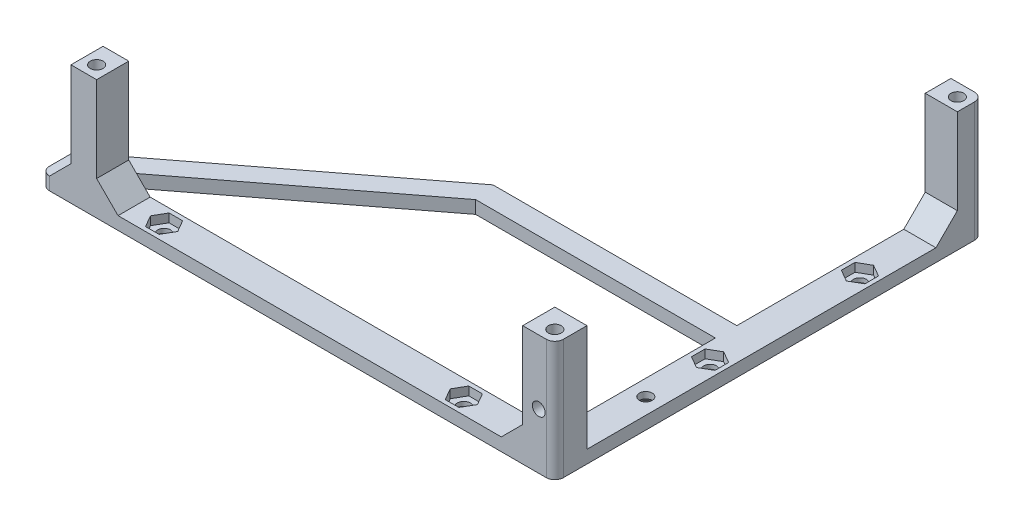
from build123d import *

# Parameters (mm, degrees)
SKETCH1_R               = 1.5
BOSS_EXTRUDE1_DEPTH     = 3
SKETCH2_W               = 6
SKETCH2_H               = 7.5
BOSS_EXTRUDE2_DEPTH     = 25
CHAMFER3_SIZE           = 5
CHAMFER6_SIZE           = 5
CHAMFER8_SIZE           = 5
SKETCH3_R               = 1.5
CUT_EXTRUDE1_DEPTH      = 107.236732571
BOSS_EXTRUDE3_DEPTH     = 3
CUT_EXTRUDE2_DEPTH      = 2
CUT_EXTRUDE3_DEPTH      = 10
CUT_EXTRUDE3_DEPTH_BACK = 106.977560584
SKETCH6_R               = 1.5
SKETCH9_R               = 1.493282486
CUT_EXTRUDE4_DEPTH      = 10
CHAMFER9_SIZE           = 1.5


with BuildPart() as part:
    # Sketch1 → Boss-Extrude1 (new body)
    with BuildSketch(Plane(origin=(0, 0, 0), x_dir=(1, 0, 0), z_dir=(0, 1, 0))):
        with BuildLine():
            Line((40.047169811, 27.523584906), (44.547169811, 27.523584906))
            Line((44.547169811, 27.523584906), (45.547169811, 27.523584906))
            ThreePointArc((45.547169811, 27.523584906), (46.961383374, 26.937798468), (47.547169811, 25.523584906))
            Line((47.547169811, 25.523584906), (47.547169811, 24.523584906))
            Line((47.547169811, 24.523584906), (47.547169811, -70.476415094))
            ThreePointArc((47.547169811, -70.476415094), (46.961383374, -71.890628657), (45.547169811, -72.476415094))
            Line((45.547169811, -72.476415094), (-69.452830189, -72.476415094))
            Line((-69.452830189, -72.476415094), (-70.452830189, -72.476415094))
            ThreePointArc((-70.452830189, -72.476415094), (-71.867043751, -71.890628657), (-72.452830189, -70.476415094))
            Line((-72.452830189, -70.476415094), (-72.452830189, -69.476415094))
            Line((-72.452830189, -69.476415094), (-72.452830189, -64.976415094))
            Line((-72.452830189, -64.976415094), (40.047169811, -64.976415094))
            Line((40.047169811, -64.976415094), (40.047169811, 27.523584906))
        make_face()
        with Locations(Location((44.547169811, 24.523584906, 0), (0, 0, 270))):
            Circle(SKETCH1_R, mode=Mode.SUBTRACT)
        with Locations(Location((44.547169811, -69.476415094, 0), (0, 0, 270))):
            Circle(SKETCH1_R, mode=Mode.SUBTRACT)
        with Locations(Location((-62.452830189, -69.476415094, 0), (0, 0, 270))):
            Circle(SKETCH1_R, mode=Mode.SUBTRACT)
    extrude(amount=BOSS_EXTRUDE1_DEPTH)

    # Sketch2 → Boss-Extrude2 (add)
    with BuildSketch(Plane(origin=(0, 3, 0), x_dir=(1, 0, 0), z_dir=(0, 1, 0))):
        with BuildLine():
            Line((40.047169811, -64.976415094), (47.547169811, -64.976415094))
            Line((47.547169811, -64.976415094), (47.547169811, -70.476415094))
            ThreePointArc((47.547169811, -70.476415094), (46.961383374, -71.890628657), (45.547169811, -72.476415094))
            Line((45.547169811, -72.476415094), (40.047169811, -72.476415094))
            Line((40.047169811, -72.476415094), (40.047169811, -64.976415094))
        make_face()
        with Locations((-62.452830189, -68.726415094)):
            Rectangle(SKETCH2_W, SKETCH2_H)
        with BuildLine():
            Line((40.047169811, 21.523584906), (47.547169811, 21.523584906))
            Line((47.547169811, 21.523584906), (47.547169811, 25.523584906))
            ThreePointArc((47.547169811, 25.523584906), (46.961383374, 26.937798468), (45.547169811, 27.523584906))
            Line((45.547169811, 27.523584906), (40.047169811, 27.523584906))
            Line((40.047169811, 27.523584906), (40.047169811, 21.523584906))
        make_face()
    extrude(amount=BOSS_EXTRUDE2_DEPTH)

    # Chamfer3
    chamfer3_edges = [part.edges().sort_by_distance(p)[0] for p in [
        (43.797169811, 3, -21.523584906),
    ]]
    chamfer(chamfer3_edges, length=CHAMFER3_SIZE)

    # Chamfer6
    # the kernel refuses this chamfer: 5 mm, written as the material it adds along each edge
    with BuildSketch(Plane(origin=(40.047169811, 3, 72.476415094), x_dir=(0.027495876610586317, 0.9996219169112968, 0), z_dir=(0, 0, -1))) as chamfer6_piece_1:
        Polygon((CHAMFER6_SIZE * 0.999621916911, -CHAMFER6_SIZE * 0.0274958766106), (-CHAMFER6_SIZE * 0.0274958766106, -CHAMFER6_SIZE * 0.999621916911), (0, 0), align=None)
    extrude(amount=7.5)

    # Chamfer8
    chamfer8_edges = [part.edges().sort_by_distance(p)[0] for p in [
        (-65.452830189, 3, 68.726415094),
        (-59.452830189, 3, 68.726415094),
    ]]
    chamfer(chamfer8_edges, length=CHAMFER8_SIZE)

    # Sketch3 → Cut-Extrude1 (cut, through all)
    with BuildSketch(Plane(origin=(0, 0, 0), x_dir=(-1, 0, 0), z_dir=(0, -1, 0))):
        with Locations(Location((62.452830189, -69.476415094, 0), (0, 0, 90))):
            Circle(SKETCH3_R)
        with Locations(Location((-44.547169811, -69.476415094, 0), (0, 0, 90))):
            Circle(SKETCH3_R)
        with Locations(Location((-44.547169811, 24.523584906, 0), (0, 0, 90))):
            Circle(SKETCH3_R)
    extrude(amount=-CUT_EXTRUDE1_DEPTH, mode=Mode.SUBTRACT)

    # Sketch4 → Boss-Extrude3 (add)
    with BuildSketch(Plane(origin=(0, 0, 0), x_dir=(-1, 0, 0), z_dir=(0, -1, 0))):
        Polygon((-40.047169811, -22.476415094), (16.900565623, -22.476415094), (72.452830189, -64.976415094), (64.952830189, -64.976415094), (15.93612616, -27.476415094), (-40.047169811, -27.476415094), align=None)
    extrude(amount=-BOSS_EXTRUDE3_DEPTH)

    # Sketch5 → Cut-Extrude2 (cut)
    with BuildSketch(Plane(origin=(0, 3, 0), x_dir=(1, 0, 0), z_dir=(0, 1, 0))):
        Polygon((-44.277403708, -68.726415094), (-45.865116948, -65.976415094), (-49.040543429, -65.976415094), (-50.628256669, -68.726415094), (-49.040543429, -71.476415094), (-45.865116948, -71.476415094), align=None)
        Polygon((25.722596292, -68.726415094), (24.134883052, -65.976415094), (20.959456571, -65.976415094), (19.371743331, -68.726415094), (20.959456571, -71.476415094), (24.134883052, -71.476415094), align=None)
        Polygon((43.797169811, -0.651841575), (46.547169811, 0.935871665), (46.547169811, 4.111298146), (43.797169811, 5.699011386), (41.047169811, 4.111298146), (41.047169811, 0.935871665), align=None)
        Polygon((43.797169811, -35.651841575), (46.547169811, -34.064128335), (46.547169811, -30.888701854), (43.797169811, -29.300988614), (41.047169811, -30.888701854), (41.047169811, -34.064128335), align=None)
    extrude(amount=-CUT_EXTRUDE2_DEPTH, mode=Mode.SUBTRACT)

    # Sketch6 → Cut-Extrude3 (cut, two sides: drawn at the far end of the back side and taken through both)
    with BuildSketch(Plane(origin=(0, 1, 0), x_dir=(1, 0, 0), z_dir=(0, 1, 0)).offset(-CUT_EXTRUDE3_DEPTH_BACK)):
        with Locations(Location((43.797169811, 2.523584906, 0), (0, 0, 270))):
            Circle(SKETCH6_R)
        with Locations(Location((43.797169811, -32.476415094, 0), (0, 0, 270))):
            Circle(SKETCH6_R)
        with Locations(Location((22.547169811, -68.726415094, 0), (0, 0, 270))):
            Circle(SKETCH6_R)
        with Locations(Location((-47.452830189, -68.726415094, 0), (0, 0, 270))):
            Circle(SKETCH6_R)
        with Locations(Location((43.797169811, -47.476415094, 0), (0, 0, 270))):
            Circle(SKETCH6_R)
    extrude(amount=CUT_EXTRUDE3_DEPTH + CUT_EXTRUDE3_DEPTH_BACK, mode=Mode.SUBTRACT)

    # Sketch9 → Cut-Extrude4 (cut)
    with BuildSketch(Plane.XY.offset(72.476415094)):
        with Locations((43.797169811, 13)):
            Circle(SKETCH9_R)
    extrude(amount=-CUT_EXTRUDE4_DEPTH, mode=Mode.SUBTRACT)

    # Chamfer9
    chamfer9_edges = [part.edges().sort_by_distance(p)[0] for p in [
        (43.797169811, 0, 45.976415094),
    ]]
    chamfer(chamfer9_edges, length=CHAMFER9_SIZE)


solid = part.part
